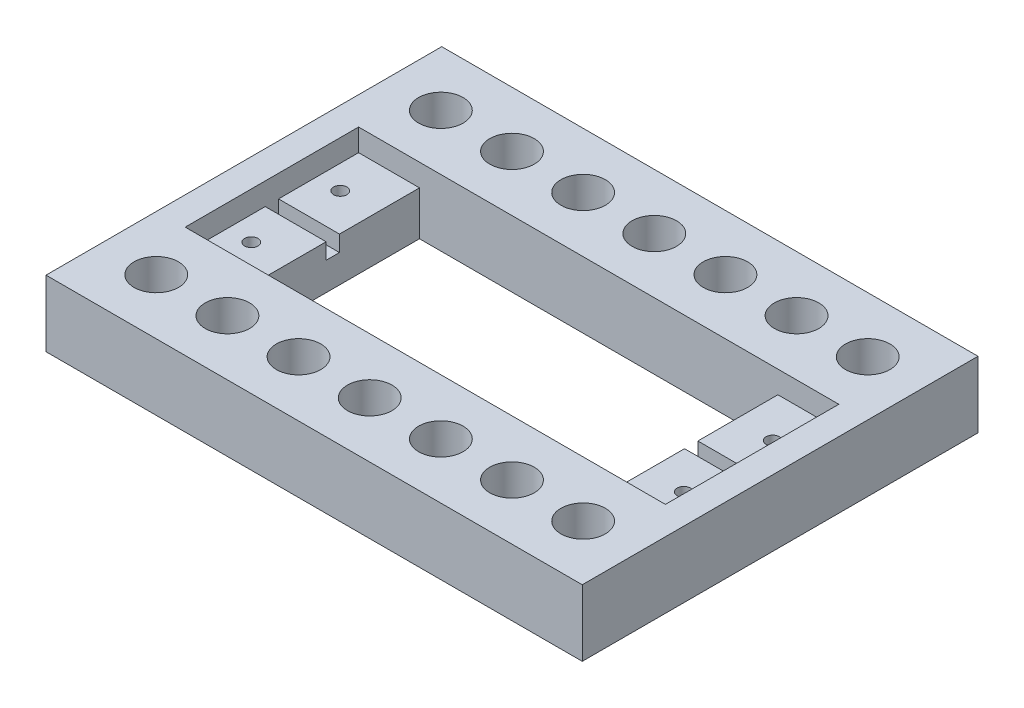
from build123d import *

# Parameters (mm, degrees)
SKETCH1_W           = 60.3
SKETCH1_H           = 44.5
SKETCH1_R           = 0.75
SKETCH1_W_2         = 40.3
SKETCH1_H_2         = 19.5
BOSS_EXTRUDE1_DEPTH = 7.46
SKETCH3_W           = 54
SKETCH3_H           = 19.5
CUT_EXTRUDE1_DEPTH  = 2.5
SKETCH4_R           = 2.5
CUT_EXTRUDE2_DEPTH  = 39.206499447
SKETCH5_W           = 6.85
SKETCH5_H           = 1.5
CUT_EXTRUDE3_DEPTH  = 1.8


with BuildPart() as part:
    # Sketch1 → Boss-Extrude1 (new body)
    with BuildSketch(Plane(origin=(0, 0, 0), x_dir=(1, 0, 0), z_dir=(0, 1, 0))):
        Rectangle(SKETCH1_W, SKETCH1_H)
        with Locations((-24.315, -5)):
            Circle(SKETCH1_R, mode=Mode.SUBTRACT)
        with Locations((-24.315, 5)):
            Circle(SKETCH1_R, mode=Mode.SUBTRACT)
        with Locations((24.315, -5)):
            Circle(SKETCH1_R, mode=Mode.SUBTRACT)
        with Locations((24.315, 5)):
            Circle(SKETCH1_R, mode=Mode.SUBTRACT)
        Rectangle(SKETCH1_W_2, SKETCH1_H_2, mode=Mode.SUBTRACT)
    extrude(amount=BOSS_EXTRUDE1_DEPTH)

    # Sketch3 → Cut-Extrude1 (cut)
    with BuildSketch(Plane(origin=(0, 7.46, 0), x_dir=(1, 0, 0), z_dir=(0, 1, 0))):
        Rectangle(SKETCH3_W, SKETCH3_H)
    extrude(amount=-CUT_EXTRUDE1_DEPTH, mode=Mode.SUBTRACT)

    # Sketch4 → Cut-Extrude2 (cut, through all)
    with BuildSketch(Plane(origin=(0, 7.46, 0), x_dir=(1, 0, 0), z_dir=(0, 1, 0))):
        with Locations((0, 16)):
            Circle(SKETCH4_R)
        with Locations((8, 16)):
            Circle(SKETCH4_R)
        with Locations((16, 16)):
            Circle(SKETCH4_R)
        with Locations((24, 16)):
            Circle(SKETCH4_R)
        with Locations((-24, 16)):
            Circle(SKETCH4_R)
        with Locations((-16, 16)):
            Circle(SKETCH4_R)
        with Locations((-8, 16)):
            Circle(SKETCH4_R)
        with Locations((24, -16)):
            Circle(SKETCH4_R)
        with Locations((16, -16)):
            Circle(SKETCH4_R)
        with Locations((8, -16)):
            Circle(SKETCH4_R)
        with Locations((0, -16)):
            Circle(SKETCH4_R)
        with Locations((-8, -16)):
            Circle(SKETCH4_R)
        with Locations((-16, -16)):
            Circle(SKETCH4_R)
        with Locations((-24, -16)):
            Circle(SKETCH4_R)
    extrude(amount=-CUT_EXTRUDE2_DEPTH, mode=Mode.SUBTRACT)

    # Sketch5 → Cut-Extrude3 (cut)
    with BuildSketch(Plane(origin=(0, 4.96, 0), x_dir=(1, 0, 0), z_dir=(0, 1, 0))):
        with Locations((-23.575, 0)):
            Rectangle(SKETCH5_W, SKETCH5_H)
        with Locations((23.575, 0)):
            Rectangle(SKETCH5_W, SKETCH5_H)
    extrude(amount=-CUT_EXTRUDE3_DEPTH, mode=Mode.SUBTRACT)


solid = part.part
